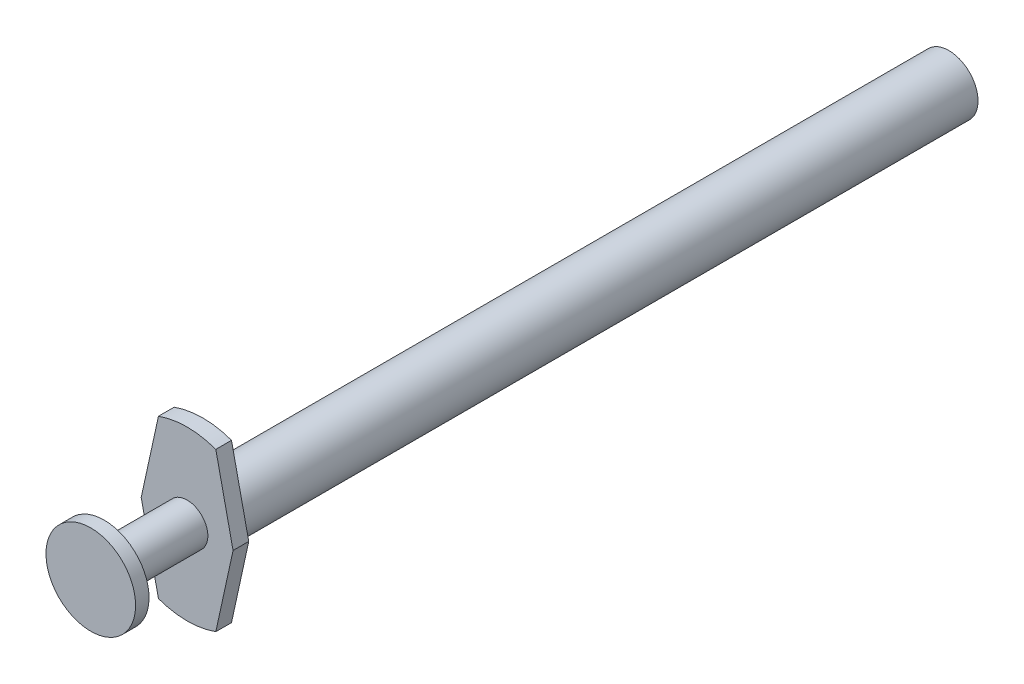
from build123d import *

# Parameters (mm, degrees)
CORTAR_EXTRUIR1_START = -1.778
CORTAR_EXTRUIR1_DEPTH = 1.778


# Read off the part's stored shape, not the designer's step: Cortar-Extruir1
with BuildPart() as part:
    # Croquis1 → Revolución1 (revolve)
    with BuildSketch(Plane(origin=(0, 0, 0), x_dir=(0, 0, -1), z_dir=(1, 0, 0))):
        Polygon((0, 0), (0, 5.08), (1.524, 5.08), (1.524, 2.3495), (10.922, 2.3495), (10.922, 9.525), (12.7, 9.525), (12.7, 3.302), (97.282, 3.302), (97.282, 0), align=None)
    revolve(axis=Axis((0, 0, -97.282), (0, 0, 1)))

    # Cortar-Extruir1 outline → Cortar-Extruir1 (cut)
    with BuildSketch(Plane.XY.offset(-10.922).offset(CORTAR_EXTRUIR1_START)):
        with BuildLine():
            Line((-3.25214663, -8.952606732), (-5.207, 0))
            Line((-5.207, 0), (-3.25214663, 8.952606732))
            ThreePointArc((-3.25214663, 8.952606732), (-9.525, 0), (-3.25214663, -8.952606732))
        make_face()
        with BuildLine():
            Line((5.207, 0), (3.25214663, -8.952606732))
            ThreePointArc((3.25214663, -8.952606732), (9.525, 0), (3.25214663, 8.952606732))
            Line((3.25214663, 8.952606732), (5.207, 0))
        make_face()
    extrude(amount=CORTAR_EXTRUIR1_DEPTH, mode=Mode.SUBTRACT)


solid = part.part
